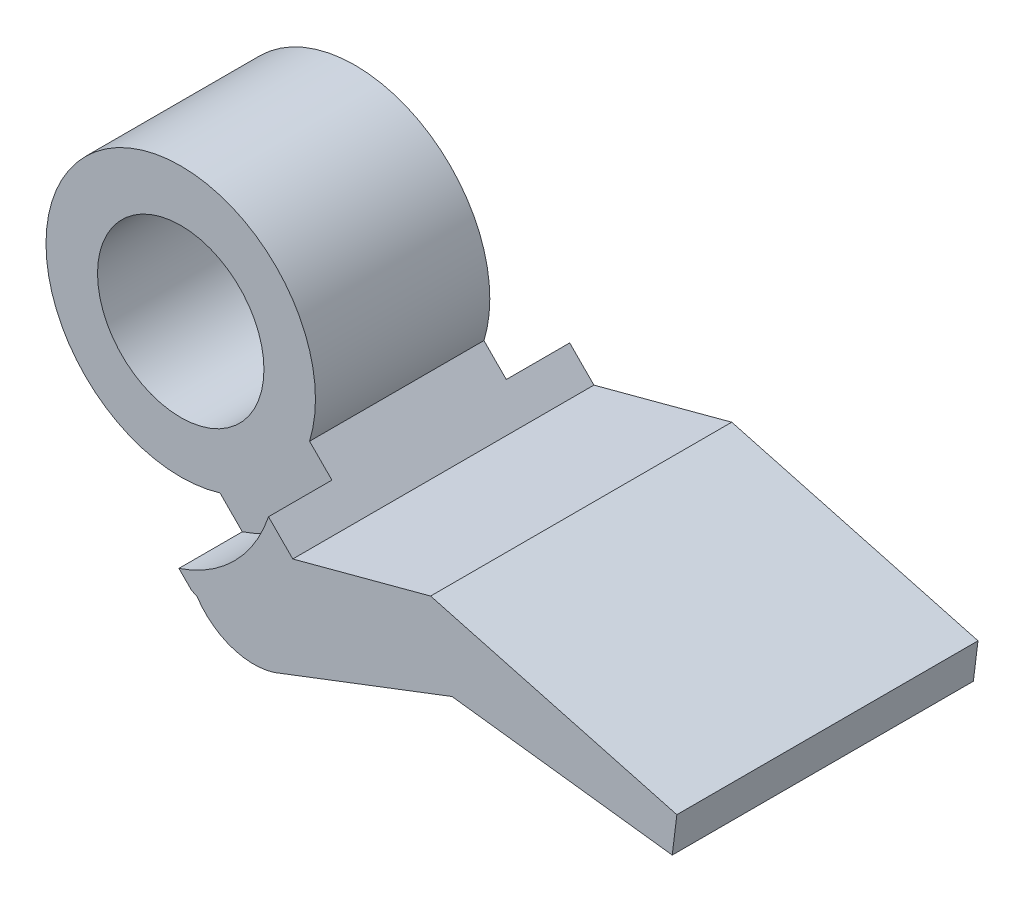
from build123d import *

# Parameters (mm, degrees)
BOSS_EXTRUDE1_OUTLINE_R = 5.250010824
BOSS_EXTRUDE1_DEPTH     = 19
CUT_EXTRUDE1_START      = -4
SKETCH2_R               = 8.500003527
CUT_EXTRUDE1_DEPTH      = 4
SKETCH3_R               = 8.500003527
CUT_EXTRUDE2_DEPTH      = 4
CUT_EXTRUDE3_START      = -4
CUT_EXTRUDE3_DEPTH      = 4
CUT_EXTRUDE4_DEPTH      = 4


# Read off the part's stored shape, not the designer's step: Boss-Extrude1
with BuildPart() as part:
    # Boss-Extrude1 outline → Boss-Extrude1 (new body)
    with BuildSketch(Plane.XY):
        with BuildLine():
            ThreePointArc((-23.133312794, -2.201771211), (-37.271533994, 6.292181292), (-28.786231545, -7.851233083))
            Line((-28.786231545, -7.851233083), (-26.586143602, -10.066323126))
            Line((-26.586143602, -10.066323126), (-26.23976909, -10.228203619))
            ThreePointArc((-26.23976909, -10.228203619), (-24.085157131, -11.906333766), (-21.354454149, -11.947983588))
            Line((-21.354454149, -11.947983588), (-10.14791118, -7.656975592))
            Line((-10.14791118, -7.656975592), (3.746314894, -9.374802435))
            Line((3.746314894, -9.374802435), (4.037513624, -7.019745673))
            Line((4.037513624, -7.019745673), (-11.498619188, -2.842881049))
            Line((-11.498619188, -2.842881049), (-20.193931688, -5.164955939))
            Line((-20.193931688, -5.164955939), (-23.133312794, -2.201771211))
        make_face()
        with Locations((-31.26296245, 0.27993313)):
            Circle(BOSS_EXTRUDE1_OUTLINE_R, mode=Mode.SUBTRACT)
    extrude(amount=BOSS_EXTRUDE1_DEPTH)

    # Sketch2 → Cut-Extrude1 (cut)
    with BuildSketch(Plane.XY.offset(19).offset(CUT_EXTRUDE1_START)):
        with Locations((-31.26296245, 0.27993313)):
            Circle(SKETCH2_R)
    extrude(amount=CUT_EXTRUDE1_DEPTH, mode=Mode.SUBTRACT)

    # Sketch3 → Cut-Extrude2 (cut)
    with BuildSketch(Plane(origin=(0, 0, 0), x_dir=(-1, 0, 0), z_dir=(0, 0, -1))):
        with Locations((31.26296245, 0.27993313)):
            Circle(SKETCH3_R)
    extrude(amount=-CUT_EXTRUDE2_DEPTH, mode=Mode.SUBTRACT)

    # Sketch4 → Cut-Extrude3 (cut)
    with BuildSketch(Plane.XY.offset(19).offset(CUT_EXTRUDE3_START)):
        with BuildLine():
            Line((-28.786231545, -7.851233083), (-27.3768314, -9.270243736))
            ThreePointArc((-27.3768314, -9.270243736), (-23.881833101, -7.115358231), (-21.724813867, -3.621676409))
            Line((-21.724813867, -3.621676409), (-23.133312794, -2.201771211))
            ThreePointArc((-23.133312794, -2.201771211), (-25.254390905, -5.732315031), (-28.786231545, -7.851233083))
        make_face()
    extrude(amount=CUT_EXTRUDE3_DEPTH, mode=Mode.SUBTRACT)

    # Sketch5 → Cut-Extrude4 (cut)
    with BuildSketch(Plane(origin=(0, 0, 0), x_dir=(-1, 0, 0), z_dir=(0, 0, -1))):
        with BuildLine():
            Line((23.133312794, -2.201771211), (21.719099232, -3.615984773))
            ThreePointArc((21.719099232, -3.615984773), (24.169813566, -6.821498289), (27.3768314, -9.270243736))
            Line((27.3768314, -9.270243736), (28.786231545, -7.851233083))
            ThreePointArc((28.786231545, -7.851233083), (25.254390905, -5.732315031), (23.133312794, -2.201771211))
        make_face()
    extrude(amount=-CUT_EXTRUDE4_DEPTH, mode=Mode.SUBTRACT)


solid = part.part
